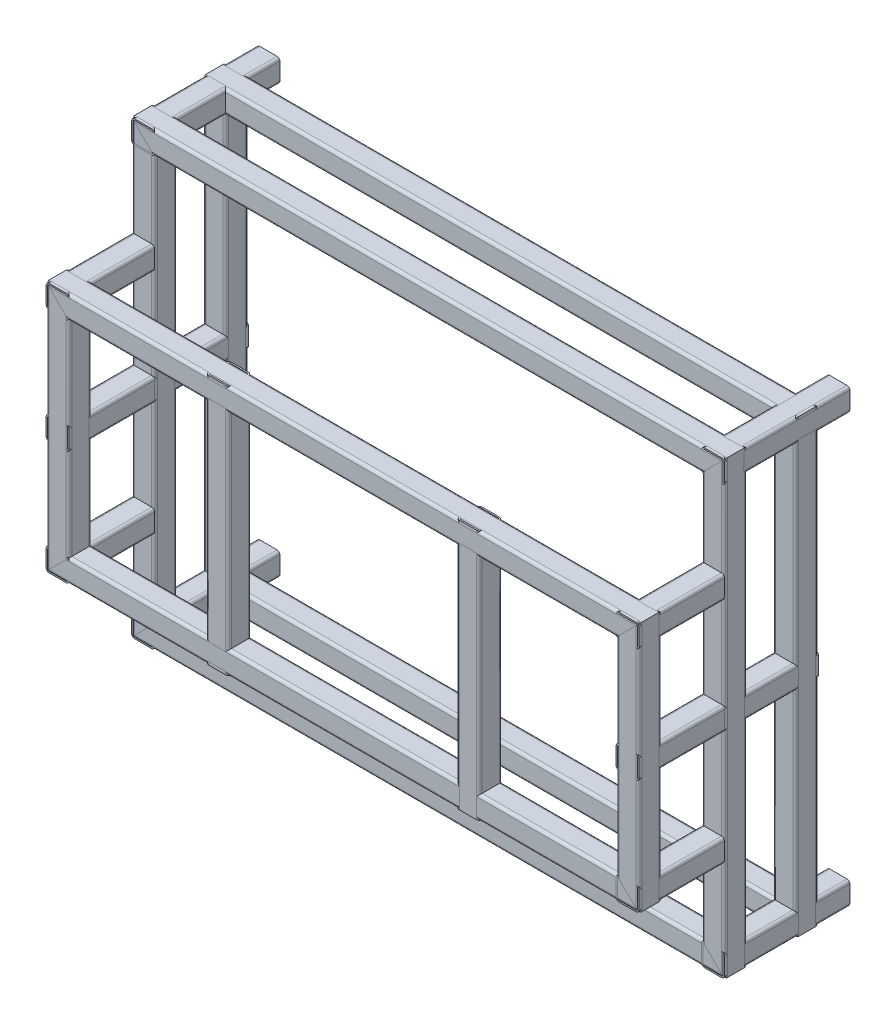
from build123d import *

# Parameters (mm, degrees)
SQUARE_TUBE_80_X_80_X_5_1_DEPTH       = 2194.13708499
SQUARE_TUBE_80_X_80_X_5_1_DEPTH_BACK  = 114.13708499
SQUARE_TUBE_80_X_80_X_5_1_2_DEPTH     = 1108.27416998
SQUARE_TUBE_80_X_80_X_5_1_3_DEPTH     = 2308.27416998
SQUARE_TUBE_80_X_80_X_5_1_4_DEPTH     = 1108.27416998
SQUARE_TUBE_80_X_80_X_5_2_DEPTH       = 880
SQUARE_TUBE_80_X_80_X_5_2_2_DEPTH     = 880
SQUARE_TUBE_80_X_80_X_5_3_DEPTH       = 300
SQUARE_TUBE_80_X_80_X_5_7_DEPTH       = 300
SQUARE_TUBE_80_X_80_X_5_8_DEPTH       = 300
SQUARE_TUBE_80_X_80_X_5_9_DEPTH       = 300
SQUARE_TUBE_80_X_80_X_5_10_DEPTH      = 1694.13708499
SQUARE_TUBE_80_X_80_X_5_10_DEPTH_BACK = 114.13708499
SQUARE_TUBE_80_X_80_X_5_10_2_DEPTH    = 2308.27416998
SQUARE_TUBE_80_X_80_X_5_10_3_DEPTH    = 1808.27416998
SQUARE_TUBE_80_X_80_X_5_10_4_DEPTH    = 2308.27416998
SQUARE_TUBE_80_X_80_X_5_11_DEPTH      = 1694.13708499
SQUARE_TUBE_80_X_80_X_5_11_DEPTH_BACK = 114.13708499
SQUARE_TUBE_80_X_80_X_5_11_2_DEPTH    = 2308.27416998
SQUARE_TUBE_80_X_80_X_5_11_3_DEPTH    = 1808.27416998
SQUARE_TUBE_80_X_80_X_5_11_4_DEPTH    = 2308.27416998
SQUARE_TUBE_80_X_80_X_5_12_DEPTH      = 440
SQUARE_TUBE_80_X_80_X_5_13_DEPTH      = 440
SQUARE_TUBE_80_X_80_X_5_14_DEPTH      = 440
SQUARE_TUBE_80_X_80_X_5_15_DEPTH      = 440
SQUARE_START                          = -300
SQUARE_TUBE_80_X_80_X_5_16_DEPTH      = 300
SQUARE_START_2                        = -630
SQUARE_TUBE_80_X_80_X_5_16_2_DEPTH    = 330


with BuildPart() as part:
    # Sketch15 → Square tube 80 X 80 X 5(1) (new, two sides: drawn at the far end of the back side and taken through both)
    with BuildSketch(Plane(origin=(-1040, -400, -40), x_dir=(0, 0, -1), z_dir=(1, 0, 0)).offset(-SQUARE_TUBE_80_X_80_X_5_1_DEPTH_BACK)):
        with BuildLine():
            Line((-30, -40), (30, -40))
            ThreePointArc((30, -40), (37.071067812, -37.071067812), (40, -30))
            Line((40, -30), (40, 30))
            ThreePointArc((40, 30), (37.071067812, 37.071067812), (30, 40))
            Line((30, 40), (-30, 40))
            ThreePointArc((-30, 40), (-37.071067812, 37.071067812), (-40, 30))
            Line((-40, 30), (-40, -30))
            ThreePointArc((-40, -30), (-37.071067812, -37.071067812), (-30, -40))
        make_face()
        with BuildLine():
            Line((-30, -35), (30, -35))
            ThreePointArc((30, -35), (33.535533906, -33.535533906), (35, -30))
            Line((35, -30), (35, 30))
            ThreePointArc((35, 30), (33.535533906, 33.535533906), (30, 35))
            Line((30, 35), (-30, 35))
            ThreePointArc((-30, 35), (-33.535533906, 33.535533906), (-35, 30))
            Line((-35, 30), (-35, -30))
            ThreePointArc((-35, -30), (-33.535533906, -33.535533906), (-30, -35))
        make_face(mode=Mode.SUBTRACT)
    extrude(amount=SQUARE_TUBE_80_X_80_X_5_1_DEPTH + SQUARE_TUBE_80_X_80_X_5_1_DEPTH_BACK)

    # Square tube 80 X 80 X 5(1) mitre 1
    split(bisect_by=Plane(origin=(-1040, -440, 0), x_dir=(0.707106781, 0.707106781, 0), z_dir=(0.707106781, -0.707106781, 0)), keep=Keep.TOP)

    # Square tube 80 X 80 X 5(1) mitre 2
    split(bisect_by=Plane(origin=(1040, -440, 0), x_dir=(0.707106781, -0.707106781, 0), z_dir=(-0.707106781, -0.707106781, 0)), keep=Keep.TOP)


with BuildPart() as body_2:
    # Sketch15 on segment 2 (carried to segment 2) → Square tube 80 X 80 X 5_1 2 (new body)
    with BuildSketch(Plane(origin=(1000, -554.13708499, -40), x_dir=(0, 0, -1), z_dir=(0, 1, 0))):
        with BuildLine():
            Line((-30, -40), (30, -40))
            ThreePointArc((30, -40), (37.071067812, -37.071067812), (40, -30))
            Line((40, -30), (40, 30))
            ThreePointArc((40, 30), (37.071067812, 37.071067812), (30, 40))
            Line((30, 40), (-30, 40))
            ThreePointArc((-30, 40), (-37.071067812, 37.071067812), (-40, 30))
            Line((-40, 30), (-40, -30))
            ThreePointArc((-40, -30), (-37.071067812, -37.071067812), (-30, -40))
        make_face()
        with BuildLine():
            Line((-30, -35), (30, -35))
            ThreePointArc((30, -35), (33.535533906, -33.535533906), (35, -30))
            Line((35, -30), (35, 30))
            ThreePointArc((35, 30), (33.535533906, 33.535533906), (30, 35))
            Line((30, 35), (-30, 35))
            ThreePointArc((-30, 35), (-33.535533906, 33.535533906), (-35, 30))
            Line((-35, 30), (-35, -30))
            ThreePointArc((-35, -30), (-33.535533906, -33.535533906), (-30, -35))
        make_face(mode=Mode.SUBTRACT)
    extrude(amount=SQUARE_TUBE_80_X_80_X_5_1_2_DEPTH)

    # Square tube 80 X 80 X 5_1 2 mitre 1
    split(bisect_by=Plane(origin=(1040, -440, 0), x_dir=(-0.707106781, 0.707106781, 0), z_dir=(0.707106781, 0.707106781, 0)), keep=Keep.TOP)

    # Square tube 80 X 80 X 5_1 2 mitre 2
    split(bisect_by=Plane(origin=(1040, 440, 0), x_dir=(0.707106781, 0.707106781, 0), z_dir=(0.707106781, -0.707106781, 0)), keep=Keep.TOP)


with BuildPart() as body_3:
    # Sketch15 on segment 3 (carried to segment 3) → Square tube 80 X 80 X 5_1 3 (new body)
    with BuildSketch(Plane(origin=(1154.13708499, 400, -40), x_dir=(0, 0, -1), z_dir=(-1, 0, 0))):
        with BuildLine():
            Line((-30, -40), (30, -40))
            ThreePointArc((30, -40), (37.071067812, -37.071067812), (40, -30))
            Line((40, -30), (40, 30))
            ThreePointArc((40, 30), (37.071067812, 37.071067812), (30, 40))
            Line((30, 40), (-30, 40))
            ThreePointArc((-30, 40), (-37.071067812, 37.071067812), (-40, 30))
            Line((-40, 30), (-40, -30))
            ThreePointArc((-40, -30), (-37.071067812, -37.071067812), (-30, -40))
        make_face()
        with BuildLine():
            Line((-30, -35), (30, -35))
            ThreePointArc((30, -35), (33.535533906, -33.535533906), (35, -30))
            Line((35, -30), (35, 30))
            ThreePointArc((35, 30), (33.535533906, 33.535533906), (30, 35))
            Line((30, 35), (-30, 35))
            ThreePointArc((-30, 35), (-33.535533906, 33.535533906), (-35, 30))
            Line((-35, 30), (-35, -30))
            ThreePointArc((-35, -30), (-33.535533906, -33.535533906), (-30, -35))
        make_face(mode=Mode.SUBTRACT)
    extrude(amount=SQUARE_TUBE_80_X_80_X_5_1_3_DEPTH)

    # Square tube 80 X 80 X 5_1 3 mitre 1
    split(bisect_by=Plane(origin=(-1040, 440, 0), x_dir=(-0.707106781, 0.707106781, 0), z_dir=(0.707106781, 0.707106781, 0)), keep=Keep.TOP)

    # Square tube 80 X 80 X 5_1 3 mitre 2
    split(bisect_by=Plane(origin=(1040, 440, 0), x_dir=(-0.707106781, -0.707106781, 0), z_dir=(-0.707106781, 0.707106781, 0)), keep=Keep.TOP)


with BuildPart() as body_4:
    # Sketch15 on segment 4 (carried to segment 4) → Square tube 80 X 80 X 5_1 4 (new body)
    with BuildSketch(Plane(origin=(-1000, 554.13708499, -40), x_dir=(0, 0, -1), z_dir=(0, -1, 0))):
        with BuildLine():
            Line((-30, -40), (30, -40))
            ThreePointArc((30, -40), (37.071067812, -37.071067812), (40, -30))
            Line((40, -30), (40, 30))
            ThreePointArc((40, 30), (37.071067812, 37.071067812), (30, 40))
            Line((30, 40), (-30, 40))
            ThreePointArc((-30, 40), (-37.071067812, 37.071067812), (-40, 30))
            Line((-40, 30), (-40, -30))
            ThreePointArc((-40, -30), (-37.071067812, -37.071067812), (-30, -40))
        make_face()
        with BuildLine():
            Line((-30, -35), (30, -35))
            ThreePointArc((30, -35), (33.535533906, -33.535533906), (35, -30))
            Line((35, -30), (35, 30))
            ThreePointArc((35, 30), (33.535533906, 33.535533906), (30, 35))
            Line((30, 35), (-30, 35))
            ThreePointArc((-30, 35), (-33.535533906, 33.535533906), (-35, 30))
            Line((-35, 30), (-35, -30))
            ThreePointArc((-35, -30), (-33.535533906, -33.535533906), (-30, -35))
        make_face(mode=Mode.SUBTRACT)
    extrude(amount=SQUARE_TUBE_80_X_80_X_5_1_4_DEPTH)

    # Square tube 80 X 80 X 5_1 4 mitre 1
    split(bisect_by=Plane(origin=(-1040, -440, 0), x_dir=(-0.707106781, -0.707106781, 0), z_dir=(-0.707106781, 0.707106781, 0)), keep=Keep.TOP)

    # Square tube 80 X 80 X 5_1 4 mitre 2
    split(bisect_by=Plane(origin=(-1040, 440, 0), x_dir=(0.707106781, -0.707106781, 0), z_dir=(-0.707106781, -0.707106781, 0)), keep=Keep.TOP)


with BuildPart() as body_5:
    # Sketch1 → Square tube 80 X 80 X 5(2) (new body)
    with BuildSketch(Plane(origin=(440, -440, -40), x_dir=(1, 0, 0), z_dir=(0, 1, 0))):
        with BuildLine():
            Line((-30, -40), (30, -40))
            ThreePointArc((30, -40), (37.071067812, -37.071067812), (40, -30))
            Line((40, -30), (40, 30))
            ThreePointArc((40, 30), (37.071067812, 37.071067812), (30, 40))
            Line((30, 40), (-30, 40))
            ThreePointArc((-30, 40), (-37.071067812, 37.071067812), (-40, 30))
            Line((-40, 30), (-40, -30))
            ThreePointArc((-40, -30), (-37.071067812, -37.071067812), (-30, -40))
        make_face()
        with BuildLine():
            Line((-30, -35), (30, -35))
            ThreePointArc((30, -35), (33.535533906, -33.535533906), (35, -30))
            Line((35, -30), (35, 30))
            ThreePointArc((35, 30), (33.535533906, 33.535533906), (30, 35))
            Line((30, 35), (-30, 35))
            ThreePointArc((-30, 35), (-33.535533906, 33.535533906), (-35, 30))
            Line((-35, 30), (-35, -30))
            ThreePointArc((-35, -30), (-33.535533906, -33.535533906), (-30, -35))
        make_face(mode=Mode.SUBTRACT)
    extrude(amount=SQUARE_TUBE_80_X_80_X_5_2_DEPTH)


with BuildPart() as body_6:
    # Sketch1 on segment 2 (carried to segment 2) → Square tube 80 X 80 X 5_2 2 (new body)
    with BuildSketch(Plane(origin=(-440, -440, -40), x_dir=(1, 0, 0), z_dir=(0, 1, 0))):
        with BuildLine():
            Line((-30, -40), (30, -40))
            ThreePointArc((30, -40), (37.071067812, -37.071067812), (40, -30))
            Line((40, -30), (40, 30))
            ThreePointArc((40, 30), (37.071067812, 37.071067812), (30, 40))
            Line((30, 40), (-30, 40))
            ThreePointArc((-30, 40), (-37.071067812, 37.071067812), (-40, 30))
            Line((-40, 30), (-40, -30))
            ThreePointArc((-40, -30), (-37.071067812, -37.071067812), (-30, -40))
        make_face()
        with BuildLine():
            Line((-30, -35), (30, -35))
            ThreePointArc((30, -35), (33.535533906, -33.535533906), (35, -30))
            Line((35, -30), (35, 30))
            ThreePointArc((35, 30), (33.535533906, 33.535533906), (30, 35))
            Line((30, 35), (-30, 35))
            ThreePointArc((-30, 35), (-33.535533906, 33.535533906), (-35, 30))
            Line((-35, 30), (-35, -30))
            ThreePointArc((-35, -30), (-33.535533906, -33.535533906), (-30, -35))
        make_face(mode=Mode.SUBTRACT)
    extrude(amount=SQUARE_TUBE_80_X_80_X_5_2_2_DEPTH)


with BuildPart() as body_7:
    # Sketch16 → Square tube 80 X 80 X 5(3) (new body)
    with BuildSketch(Plane(origin=(1000, 400, 0), x_dir=(1, 0, 0), z_dir=(0, 0, -1))):
        with BuildLine():
            Line((-30, -40), (30, -40))
            ThreePointArc((30, -40), (37.071067812, -37.071067812), (40, -30))
            Line((40, -30), (40, 30))
            ThreePointArc((40, 30), (37.071067812, 37.071067812), (30, 40))
            Line((30, 40), (-30, 40))
            ThreePointArc((-30, 40), (-37.071067812, 37.071067812), (-40, 30))
            Line((-40, 30), (-40, -30))
            ThreePointArc((-40, -30), (-37.071067812, -37.071067812), (-30, -40))
        make_face()
        with BuildLine():
            Line((-30, -35), (30, -35))
            ThreePointArc((30, -35), (33.535533906, -33.535533906), (35, -30))
            Line((35, -30), (35, 30))
            ThreePointArc((35, 30), (33.535533906, 33.535533906), (30, 35))
            Line((30, 35), (-30, 35))
            ThreePointArc((-30, 35), (-33.535533906, 33.535533906), (-35, 30))
            Line((-35, 30), (-35, -30))
            ThreePointArc((-35, -30), (-33.535533906, -33.535533906), (-30, -35))
        make_face(mode=Mode.SUBTRACT)
    extrude(amount=SQUARE_TUBE_80_X_80_X_5_3_DEPTH)


with BuildPart() as body_8:
    # Sketch17 → Square tube 80 X 80 X 5(7) (new body)
    with BuildSketch(Plane(origin=(1000, -400, 0), x_dir=(1, 0, 0), z_dir=(0, 0, -1))):
        with BuildLine():
            Line((-30, -40), (30, -40))
            ThreePointArc((30, -40), (37.071067812, -37.071067812), (40, -30))
            Line((40, -30), (40, 30))
            ThreePointArc((40, 30), (37.071067812, 37.071067812), (30, 40))
            Line((30, 40), (-30, 40))
            ThreePointArc((-30, 40), (-37.071067812, 37.071067812), (-40, 30))
            Line((-40, 30), (-40, -30))
            ThreePointArc((-40, -30), (-37.071067812, -37.071067812), (-30, -40))
        make_face()
        with BuildLine():
            Line((-30, -35), (30, -35))
            ThreePointArc((30, -35), (33.535533906, -33.535533906), (35, -30))
            Line((35, -30), (35, 30))
            ThreePointArc((35, 30), (33.535533906, 33.535533906), (30, 35))
            Line((30, 35), (-30, 35))
            ThreePointArc((-30, 35), (-33.535533906, 33.535533906), (-35, 30))
            Line((-35, 30), (-35, -30))
            ThreePointArc((-35, -30), (-33.535533906, -33.535533906), (-30, -35))
        make_face(mode=Mode.SUBTRACT)
    extrude(amount=SQUARE_TUBE_80_X_80_X_5_7_DEPTH)


with BuildPart() as body_9:
    # Sketch18 → Square tube 80 X 80 X 5(8) (new body)
    with BuildSketch(Plane(origin=(-1000, -400, 0), x_dir=(1, 0, 0), z_dir=(0, 0, -1))):
        with BuildLine():
            Line((-30, -40), (30, -40))
            ThreePointArc((30, -40), (37.071067812, -37.071067812), (40, -30))
            Line((40, -30), (40, 30))
            ThreePointArc((40, 30), (37.071067812, 37.071067812), (30, 40))
            Line((30, 40), (-30, 40))
            ThreePointArc((-30, 40), (-37.071067812, 37.071067812), (-40, 30))
            Line((-40, 30), (-40, -30))
            ThreePointArc((-40, -30), (-37.071067812, -37.071067812), (-30, -40))
        make_face()
        with BuildLine():
            Line((-30, -35), (30, -35))
            ThreePointArc((30, -35), (33.535533906, -33.535533906), (35, -30))
            Line((35, -30), (35, 30))
            ThreePointArc((35, 30), (33.535533906, 33.535533906), (30, 35))
            Line((30, 35), (-30, 35))
            ThreePointArc((-30, 35), (-33.535533906, 33.535533906), (-35, 30))
            Line((-35, 30), (-35, -30))
            ThreePointArc((-35, -30), (-33.535533906, -33.535533906), (-30, -35))
        make_face(mode=Mode.SUBTRACT)
    extrude(amount=SQUARE_TUBE_80_X_80_X_5_8_DEPTH)


with BuildPart() as body_10:
    # Sketch19 → Square tube 80 X 80 X 5(9) (new body)
    with BuildSketch(Plane(origin=(-1000, 400, 0), x_dir=(1, 0, 0), z_dir=(0, 0, -1))):
        with BuildLine():
            Line((-30, -40), (30, -40))
            ThreePointArc((30, -40), (37.071067812, -37.071067812), (40, -30))
            Line((40, -30), (40, 30))
            ThreePointArc((40, 30), (37.071067812, 37.071067812), (30, 40))
            Line((30, 40), (-30, 40))
            ThreePointArc((-30, 40), (-37.071067812, 37.071067812), (-40, 30))
            Line((-40, 30), (-40, -30))
            ThreePointArc((-40, -30), (-37.071067812, -37.071067812), (-30, -40))
        make_face()
        with BuildLine():
            Line((-30, -35), (30, -35))
            ThreePointArc((30, -35), (33.535533906, -33.535533906), (35, -30))
            Line((35, -30), (35, 30))
            ThreePointArc((35, 30), (33.535533906, 33.535533906), (30, 35))
            Line((30, 35), (-30, 35))
            ThreePointArc((-30, 35), (-33.535533906, 33.535533906), (-35, 30))
            Line((-35, 30), (-35, -30))
            ThreePointArc((-35, -30), (-33.535533906, -33.535533906), (-30, -35))
        make_face(mode=Mode.SUBTRACT)
    extrude(amount=SQUARE_TUBE_80_X_80_X_5_9_DEPTH)


with BuildPart() as body_11:
    # Sketch110 → Square tube 80 X 80 X 5(10) (new, two sides: drawn at the far end of the back side and taken through both)
    with BuildSketch(Plane(origin=(1000, -790, -340), x_dir=(1, 0, 0), z_dir=(0, 1, 0)).offset(-SQUARE_TUBE_80_X_80_X_5_10_DEPTH_BACK)):
        with BuildLine():
            Line((-30, -40), (30, -40))
            ThreePointArc((30, -40), (37.071067812, -37.071067812), (40, -30))
            Line((40, -30), (40, 30))
            ThreePointArc((40, 30), (37.071067812, 37.071067812), (30, 40))
            Line((30, 40), (-30, 40))
            ThreePointArc((-30, 40), (-37.071067812, 37.071067812), (-40, 30))
            Line((-40, 30), (-40, -30))
            ThreePointArc((-40, -30), (-37.071067812, -37.071067812), (-30, -40))
        make_face()
        with BuildLine():
            Line((-30, -35), (30, -35))
            ThreePointArc((30, -35), (33.535533906, -33.535533906), (35, -30))
            Line((35, -30), (35, 30))
            ThreePointArc((35, 30), (33.535533906, 33.535533906), (30, 35))
            Line((30, 35), (-30, 35))
            ThreePointArc((-30, 35), (-33.535533906, 33.535533906), (-35, 30))
            Line((-35, 30), (-35, -30))
            ThreePointArc((-35, -30), (-33.535533906, -33.535533906), (-30, -35))
        make_face(mode=Mode.SUBTRACT)
    extrude(amount=SQUARE_TUBE_80_X_80_X_5_10_DEPTH + SQUARE_TUBE_80_X_80_X_5_10_DEPTH_BACK)

    # Square tube 80 X 80 X 5(10) mitre 1
    split(bisect_by=Plane(origin=(1040, -790, -300), x_dir=(-0.707106781, 0.707106781, 0), z_dir=(0.707106781, 0.707106781, 0)), keep=Keep.TOP)

    # Square tube 80 X 80 X 5(10) mitre 2
    split(bisect_by=Plane(origin=(1040, 790, -300), x_dir=(0.707106781, 0.707106781, 0), z_dir=(0.707106781, -0.707106781, 0)), keep=Keep.TOP)


with BuildPart() as body_12:
    # Sketch110 on segment 2 (carried to segment 2) → Square tube 80 X 80 X 5_10 2 (new body)
    with BuildSketch(Plane(origin=(1154.13708499, 750, -340), x_dir=(0, 1, 0), z_dir=(-1, 0, 0))):
        with BuildLine():
            Line((-30, -40), (30, -40))
            ThreePointArc((30, -40), (37.071067812, -37.071067812), (40, -30))
            Line((40, -30), (40, 30))
            ThreePointArc((40, 30), (37.071067812, 37.071067812), (30, 40))
            Line((30, 40), (-30, 40))
            ThreePointArc((-30, 40), (-37.071067812, 37.071067812), (-40, 30))
            Line((-40, 30), (-40, -30))
            ThreePointArc((-40, -30), (-37.071067812, -37.071067812), (-30, -40))
        make_face()
        with BuildLine():
            Line((-30, -35), (30, -35))
            ThreePointArc((30, -35), (33.535533906, -33.535533906), (35, -30))
            Line((35, -30), (35, 30))
            ThreePointArc((35, 30), (33.535533906, 33.535533906), (30, 35))
            Line((30, 35), (-30, 35))
            ThreePointArc((-30, 35), (-33.535533906, 33.535533906), (-35, 30))
            Line((-35, 30), (-35, -30))
            ThreePointArc((-35, -30), (-33.535533906, -33.535533906), (-30, -35))
        make_face(mode=Mode.SUBTRACT)
    extrude(amount=SQUARE_TUBE_80_X_80_X_5_10_2_DEPTH)

    # Square tube 80 X 80 X 5_10 2 mitre 1
    split(bisect_by=Plane(origin=(-1040, 790, -300), x_dir=(-0.707106781, 0.707106781, 0), z_dir=(0.707106781, 0.707106781, 0)), keep=Keep.TOP)

    # Square tube 80 X 80 X 5_10 2 mitre 2
    split(bisect_by=Plane(origin=(1040, 790, -300), x_dir=(-0.707106781, -0.707106781, 0), z_dir=(-0.707106781, 0.707106781, 0)), keep=Keep.TOP)


with BuildPart() as body_13:
    # Sketch110 on segment 3 (carried to segment 3) → Square tube 80 X 80 X 5_10 3 (new body)
    with BuildSketch(Plane(origin=(-1000, 904.13708499, -340), x_dir=(-1, 0, 0), z_dir=(0, -1, 0))):
        with BuildLine():
            Line((-30, -40), (30, -40))
            ThreePointArc((30, -40), (37.071067812, -37.071067812), (40, -30))
            Line((40, -30), (40, 30))
            ThreePointArc((40, 30), (37.071067812, 37.071067812), (30, 40))
            Line((30, 40), (-30, 40))
            ThreePointArc((-30, 40), (-37.071067812, 37.071067812), (-40, 30))
            Line((-40, 30), (-40, -30))
            ThreePointArc((-40, -30), (-37.071067812, -37.071067812), (-30, -40))
        make_face()
        with BuildLine():
            Line((-30, -35), (30, -35))
            ThreePointArc((30, -35), (33.535533906, -33.535533906), (35, -30))
            Line((35, -30), (35, 30))
            ThreePointArc((35, 30), (33.535533906, 33.535533906), (30, 35))
            Line((30, 35), (-30, 35))
            ThreePointArc((-30, 35), (-33.535533906, 33.535533906), (-35, 30))
            Line((-35, 30), (-35, -30))
            ThreePointArc((-35, -30), (-33.535533906, -33.535533906), (-30, -35))
        make_face(mode=Mode.SUBTRACT)
    extrude(amount=SQUARE_TUBE_80_X_80_X_5_10_3_DEPTH)

    # Square tube 80 X 80 X 5_10 3 mitre 1
    split(bisect_by=Plane(origin=(-1040, -790, -300), x_dir=(-0.707106781, -0.707106781, 0), z_dir=(-0.707106781, 0.707106781, 0)), keep=Keep.TOP)

    # Square tube 80 X 80 X 5_10 3 mitre 2
    split(bisect_by=Plane(origin=(-1040, 790, -300), x_dir=(0.707106781, -0.707106781, 0), z_dir=(-0.707106781, -0.707106781, 0)), keep=Keep.TOP)


with BuildPart() as body_14:
    # Sketch110 on segment 4 (carried to segment 4) → Square tube 80 X 80 X 5_10 4 (new body)
    with BuildSketch(Plane(origin=(-1154.13708499, -750, -340), x_dir=(0, -1, 0), z_dir=(1, 0, 0))):
        with BuildLine():
            Line((-30, -40), (30, -40))
            ThreePointArc((30, -40), (37.071067812, -37.071067812), (40, -30))
            Line((40, -30), (40, 30))
            ThreePointArc((40, 30), (37.071067812, 37.071067812), (30, 40))
            Line((30, 40), (-30, 40))
            ThreePointArc((-30, 40), (-37.071067812, 37.071067812), (-40, 30))
            Line((-40, 30), (-40, -30))
            ThreePointArc((-40, -30), (-37.071067812, -37.071067812), (-30, -40))
        make_face()
        with BuildLine():
            Line((-30, -35), (30, -35))
            ThreePointArc((30, -35), (33.535533906, -33.535533906), (35, -30))
            Line((35, -30), (35, 30))
            ThreePointArc((35, 30), (33.535533906, 33.535533906), (30, 35))
            Line((30, 35), (-30, 35))
            ThreePointArc((-30, 35), (-33.535533906, 33.535533906), (-35, 30))
            Line((-35, 30), (-35, -30))
            ThreePointArc((-35, -30), (-33.535533906, -33.535533906), (-30, -35))
        make_face(mode=Mode.SUBTRACT)
    extrude(amount=SQUARE_TUBE_80_X_80_X_5_10_4_DEPTH)

    # Square tube 80 X 80 X 5_10 4 mitre 1
    split(bisect_by=Plane(origin=(1040, -790, -300), x_dir=(0.707106781, -0.707106781, 0), z_dir=(-0.707106781, -0.707106781, 0)), keep=Keep.TOP)

    # Square tube 80 X 80 X 5_10 4 mitre 2
    split(bisect_by=Plane(origin=(-1040, -790, -300), x_dir=(0.707106781, 0.707106781, 0), z_dir=(0.707106781, -0.707106781, 0)), keep=Keep.TOP)


with BuildPart() as body_15:
    # Sketch111 → Square tube 80 X 80 X 5(11) (new, two sides: drawn at the far end of the back side and taken through both)
    with BuildSketch(Plane(origin=(-1000, -790, -590), x_dir=(1, 0, 0), z_dir=(0, 1, 0)).offset(-SQUARE_TUBE_80_X_80_X_5_11_DEPTH_BACK)):
        with BuildLine():
            Line((-30, -40), (30, -40))
            ThreePointArc((30, -40), (37.071067812, -37.071067812), (40, -30))
            Line((40, -30), (40, 30))
            ThreePointArc((40, 30), (37.071067812, 37.071067812), (30, 40))
            Line((30, 40), (-30, 40))
            ThreePointArc((-30, 40), (-37.071067812, 37.071067812), (-40, 30))
            Line((-40, 30), (-40, -30))
            ThreePointArc((-40, -30), (-37.071067812, -37.071067812), (-30, -40))
        make_face()
        with BuildLine():
            Line((-30, -35), (30, -35))
            ThreePointArc((30, -35), (33.535533906, -33.535533906), (35, -30))
            Line((35, -30), (35, 30))
            ThreePointArc((35, 30), (33.535533906, 33.535533906), (30, 35))
            Line((30, 35), (-30, 35))
            ThreePointArc((-30, 35), (-33.535533906, 33.535533906), (-35, 30))
            Line((-35, 30), (-35, -30))
            ThreePointArc((-35, -30), (-33.535533906, -33.535533906), (-30, -35))
        make_face(mode=Mode.SUBTRACT)
    extrude(amount=SQUARE_TUBE_80_X_80_X_5_11_DEPTH + SQUARE_TUBE_80_X_80_X_5_11_DEPTH_BACK)

    # Square tube 80 X 80 X 5(11) mitre 1
    split(bisect_by=Plane(origin=(-1040, -790, -630), x_dir=(-0.707106781, -0.707106781, 0), z_dir=(-0.707106781, 0.707106781, 0)), keep=Keep.TOP)

    # Square tube 80 X 80 X 5(11) mitre 2
    split(bisect_by=Plane(origin=(-1040, 790, -630), x_dir=(0.707106781, -0.707106781, 0), z_dir=(-0.707106781, -0.707106781, 0)), keep=Keep.TOP)


with BuildPart() as body_16:
    # Sketch111 on segment 2 (carried to segment 2) → Square tube 80 X 80 X 5_11 2 (new body)
    with BuildSketch(Plane(origin=(-1154.13708499, 750, -590), x_dir=(0, -1, 0), z_dir=(1, 0, 0))):
        with BuildLine():
            Line((-30, -40), (30, -40))
            ThreePointArc((30, -40), (37.071067812, -37.071067812), (40, -30))
            Line((40, -30), (40, 30))
            ThreePointArc((40, 30), (37.071067812, 37.071067812), (30, 40))
            Line((30, 40), (-30, 40))
            ThreePointArc((-30, 40), (-37.071067812, 37.071067812), (-40, 30))
            Line((-40, 30), (-40, -30))
            ThreePointArc((-40, -30), (-37.071067812, -37.071067812), (-30, -40))
        make_face()
        with BuildLine():
            Line((-30, -35), (30, -35))
            ThreePointArc((30, -35), (33.535533906, -33.535533906), (35, -30))
            Line((35, -30), (35, 30))
            ThreePointArc((35, 30), (33.535533906, 33.535533906), (30, 35))
            Line((30, 35), (-30, 35))
            ThreePointArc((-30, 35), (-33.535533906, 33.535533906), (-35, 30))
            Line((-35, 30), (-35, -30))
            ThreePointArc((-35, -30), (-33.535533906, -33.535533906), (-30, -35))
        make_face(mode=Mode.SUBTRACT)
    extrude(amount=SQUARE_TUBE_80_X_80_X_5_11_2_DEPTH)

    # Square tube 80 X 80 X 5_11 2 mitre 1
    split(bisect_by=Plane(origin=(1040, 790, -630), x_dir=(-0.707106781, -0.707106781, 0), z_dir=(-0.707106781, 0.707106781, 0)), keep=Keep.TOP)

    # Square tube 80 X 80 X 5_11 2 mitre 2
    split(bisect_by=Plane(origin=(-1040, 790, -630), x_dir=(-0.707106781, 0.707106781, 0), z_dir=(0.707106781, 0.707106781, 0)), keep=Keep.TOP)


with BuildPart() as body_17:
    # Sketch111 on segment 3 (carried to segment 3) → Square tube 80 X 80 X 5_11 3 (new body)
    with BuildSketch(Plane(origin=(1000, 904.13708499, -590), x_dir=(-1, 0, 0), z_dir=(0, -1, 0))):
        with BuildLine():
            Line((-30, -40), (30, -40))
            ThreePointArc((30, -40), (37.071067812, -37.071067812), (40, -30))
            Line((40, -30), (40, 30))
            ThreePointArc((40, 30), (37.071067812, 37.071067812), (30, 40))
            Line((30, 40), (-30, 40))
            ThreePointArc((-30, 40), (-37.071067812, 37.071067812), (-40, 30))
            Line((-40, 30), (-40, -30))
            ThreePointArc((-40, -30), (-37.071067812, -37.071067812), (-30, -40))
        make_face()
        with BuildLine():
            Line((-30, -35), (30, -35))
            ThreePointArc((30, -35), (33.535533906, -33.535533906), (35, -30))
            Line((35, -30), (35, 30))
            ThreePointArc((35, 30), (33.535533906, 33.535533906), (30, 35))
            Line((30, 35), (-30, 35))
            ThreePointArc((-30, 35), (-33.535533906, 33.535533906), (-35, 30))
            Line((-35, 30), (-35, -30))
            ThreePointArc((-35, -30), (-33.535533906, -33.535533906), (-30, -35))
        make_face(mode=Mode.SUBTRACT)
    extrude(amount=SQUARE_TUBE_80_X_80_X_5_11_3_DEPTH)

    # Square tube 80 X 80 X 5_11 3 mitre 1
    split(bisect_by=Plane(origin=(1040, -790, -630), x_dir=(-0.707106781, 0.707106781, 0), z_dir=(0.707106781, 0.707106781, 0)), keep=Keep.TOP)

    # Square tube 80 X 80 X 5_11 3 mitre 2
    split(bisect_by=Plane(origin=(1040, 790, -630), x_dir=(0.707106781, 0.707106781, 0), z_dir=(0.707106781, -0.707106781, 0)), keep=Keep.TOP)


with BuildPart() as body_18:
    # Sketch111 on segment 4 (carried to segment 4) → Square tube 80 X 80 X 5_11 4 (new body)
    with BuildSketch(Plane(origin=(1154.13708499, -750, -590), x_dir=(0, 1, 0), z_dir=(-1, 0, 0))):
        with BuildLine():
            Line((-30, -40), (30, -40))
            ThreePointArc((30, -40), (37.071067812, -37.071067812), (40, -30))
            Line((40, -30), (40, 30))
            ThreePointArc((40, 30), (37.071067812, 37.071067812), (30, 40))
            Line((30, 40), (-30, 40))
            ThreePointArc((-30, 40), (-37.071067812, 37.071067812), (-40, 30))
            Line((-40, 30), (-40, -30))
            ThreePointArc((-40, -30), (-37.071067812, -37.071067812), (-30, -40))
        make_face()
        with BuildLine():
            Line((-30, -35), (30, -35))
            ThreePointArc((30, -35), (33.535533906, -33.535533906), (35, -30))
            Line((35, -30), (35, 30))
            ThreePointArc((35, 30), (33.535533906, 33.535533906), (30, 35))
            Line((30, 35), (-30, 35))
            ThreePointArc((-30, 35), (-33.535533906, 33.535533906), (-35, 30))
            Line((-35, 30), (-35, -30))
            ThreePointArc((-35, -30), (-33.535533906, -33.535533906), (-30, -35))
        make_face(mode=Mode.SUBTRACT)
    extrude(amount=SQUARE_TUBE_80_X_80_X_5_11_4_DEPTH)

    # Square tube 80 X 80 X 5_11 4 mitre 1
    split(bisect_by=Plane(origin=(-1040, -790, -630), x_dir=(0.707106781, 0.707106781, 0), z_dir=(0.707106781, -0.707106781, 0)), keep=Keep.TOP)

    # Square tube 80 X 80 X 5_11 4 mitre 2
    split(bisect_by=Plane(origin=(1040, -790, -630), x_dir=(0.707106781, -0.707106781, 0), z_dir=(-0.707106781, -0.707106781, 0)), keep=Keep.TOP)


with BuildPart() as body_19:
    # Sketch112 → Square tube 80 X 80 X 5(12) (new body)
    with BuildSketch(Plane(origin=(-1000, -750, -300), x_dir=(1, 0, 0), z_dir=(0, 0, -1))):
        with BuildLine():
            Line((-30, -40), (30, -40))
            ThreePointArc((30, -40), (37.071067812, -37.071067812), (40, -30))
            Line((40, -30), (40, 30))
            ThreePointArc((40, 30), (37.071067812, 37.071067812), (30, 40))
            Line((30, 40), (-30, 40))
            ThreePointArc((-30, 40), (-37.071067812, 37.071067812), (-40, 30))
            Line((-40, 30), (-40, -30))
            ThreePointArc((-40, -30), (-37.071067812, -37.071067812), (-30, -40))
        make_face()
        with BuildLine():
            Line((-30, -35), (30, -35))
            ThreePointArc((30, -35), (33.535533906, -33.535533906), (35, -30))
            Line((35, -30), (35, 30))
            ThreePointArc((35, 30), (33.535533906, 33.535533906), (30, 35))
            Line((30, 35), (-30, 35))
            ThreePointArc((-30, 35), (-33.535533906, 33.535533906), (-35, 30))
            Line((-35, 30), (-35, -30))
            ThreePointArc((-35, -30), (-33.535533906, -33.535533906), (-30, -35))
        make_face(mode=Mode.SUBTRACT)
    extrude(amount=SQUARE_TUBE_80_X_80_X_5_12_DEPTH)


with BuildPart() as body_20:
    # Sketch113 → Square tube 80 X 80 X 5(13) (new body)
    with BuildSketch(Plane(origin=(-1000, 750, -300), x_dir=(1, 0, 0), z_dir=(0, 0, -1))):
        with BuildLine():
            Line((-30, -40), (30, -40))
            ThreePointArc((30, -40), (37.071067812, -37.071067812), (40, -30))
            Line((40, -30), (40, 30))
            ThreePointArc((40, 30), (37.071067812, 37.071067812), (30, 40))
            Line((30, 40), (-30, 40))
            ThreePointArc((-30, 40), (-37.071067812, 37.071067812), (-40, 30))
            Line((-40, 30), (-40, -30))
            ThreePointArc((-40, -30), (-37.071067812, -37.071067812), (-30, -40))
        make_face()
        with BuildLine():
            Line((-30, -35), (30, -35))
            ThreePointArc((30, -35), (33.535533906, -33.535533906), (35, -30))
            Line((35, -30), (35, 30))
            ThreePointArc((35, 30), (33.535533906, 33.535533906), (30, 35))
            Line((30, 35), (-30, 35))
            ThreePointArc((-30, 35), (-33.535533906, 33.535533906), (-35, 30))
            Line((-35, 30), (-35, -30))
            ThreePointArc((-35, -30), (-33.535533906, -33.535533906), (-30, -35))
        make_face(mode=Mode.SUBTRACT)
    extrude(amount=SQUARE_TUBE_80_X_80_X_5_13_DEPTH)


with BuildPart() as body_21:
    # Sketch114 → Square tube 80 X 80 X 5(14) (new body)
    with BuildSketch(Plane(origin=(1000, -750, -300), x_dir=(1, 0, 0), z_dir=(0, 0, -1))):
        with BuildLine():
            Line((-30, -40), (30, -40))
            ThreePointArc((30, -40), (37.071067812, -37.071067812), (40, -30))
            Line((40, -30), (40, 30))
            ThreePointArc((40, 30), (37.071067812, 37.071067812), (30, 40))
            Line((30, 40), (-30, 40))
            ThreePointArc((-30, 40), (-37.071067812, 37.071067812), (-40, 30))
            Line((-40, 30), (-40, -30))
            ThreePointArc((-40, -30), (-37.071067812, -37.071067812), (-30, -40))
        make_face()
        with BuildLine():
            Line((-30, -35), (30, -35))
            ThreePointArc((30, -35), (33.535533906, -33.535533906), (35, -30))
            Line((35, -30), (35, 30))
            ThreePointArc((35, 30), (33.535533906, 33.535533906), (30, 35))
            Line((30, 35), (-30, 35))
            ThreePointArc((-30, 35), (-33.535533906, 33.535533906), (-35, 30))
            Line((-35, 30), (-35, -30))
            ThreePointArc((-35, -30), (-33.535533906, -33.535533906), (-30, -35))
        make_face(mode=Mode.SUBTRACT)
    extrude(amount=SQUARE_TUBE_80_X_80_X_5_14_DEPTH)


with BuildPart() as body_22:
    # Sketch115 → Square tube 80 X 80 X 5(15) (new body)
    with BuildSketch(Plane(origin=(1000, 750, -300), x_dir=(1, 0, 0), z_dir=(0, 0, -1))):
        with BuildLine():
            Line((-30, -40), (30, -40))
            ThreePointArc((30, -40), (37.071067812, -37.071067812), (40, -30))
            Line((40, -30), (40, 30))
            ThreePointArc((40, 30), (37.071067812, 37.071067812), (30, 40))
            Line((30, 40), (-30, 40))
            ThreePointArc((-30, 40), (-37.071067812, 37.071067812), (-40, 30))
            Line((-40, 30), (-40, -30))
            ThreePointArc((-40, -30), (-37.071067812, -37.071067812), (-30, -40))
        make_face()
        with BuildLine():
            Line((-30, -35), (30, -35))
            ThreePointArc((30, -35), (33.535533906, -33.535533906), (35, -30))
            Line((35, -30), (35, 30))
            ThreePointArc((35, 30), (33.535533906, 33.535533906), (30, 35))
            Line((30, 35), (-30, 35))
            ThreePointArc((-30, 35), (-33.535533906, 33.535533906), (-35, 30))
            Line((-35, 30), (-35, -30))
            ThreePointArc((-35, -30), (-33.535533906, -33.535533906), (-30, -35))
        make_face(mode=Mode.SUBTRACT)
    extrude(amount=SQUARE_TUBE_80_X_80_X_5_15_DEPTH)


with BuildPart() as body_23:
    # Square tube 80 X 80 X 5(16): read off the stored shape, not the designer's step
    # Square tube 80 X 80 X 5(16) outline → Square tube 80 X 80 X 5(16) (new body)
    with BuildSketch(Plane.XY.offset(SQUARE_START)):
        with BuildLine():
            Line((970, -40), (1030, -40))
            ThreePointArc((1030, -40), (1037.071067812, -37.071067812), (1040, -30))
            Line((1040, -30), (1040, 30))
            ThreePointArc((1040, 30), (1037.071067812, 37.071067812), (1030, 40))
            Line((1030, 40), (970, 40))
            ThreePointArc((970, 40), (962.928932188, 37.071067812), (960, 30))
            Line((960, 30), (960, -30))
            ThreePointArc((960, -30), (962.928932188, -37.071067812), (970, -40))
        make_face()
        with BuildLine():
            ThreePointArc((970, -35), (966.464466094, -33.535533906), (965, -30))
            Line((965, -30), (965, 30))
            ThreePointArc((965, 30), (966.464466094, 33.535533906), (970, 35))
            Line((970, 35), (1030, 35))
            ThreePointArc((1030, 35), (1033.535533906, 33.535533906), (1035, 30))
            Line((1035, 30), (1035, -30))
            ThreePointArc((1035, -30), (1033.535533906, -33.535533906), (1030, -35))
            Line((1030, -35), (970, -35))
        make_face(mode=Mode.SUBTRACT)
    extrude(amount=SQUARE_TUBE_80_X_80_X_5_16_DEPTH)


with BuildPart() as body_24:
    # Square tube 80 X 80 X 5_16 2 outline → Square tube 80 X 80 X 5_16 2 (new body)
    with BuildSketch(Plane.XY.offset(SQUARE_START_2)):
        with BuildLine():
            Line((970, -40), (1030, -40))
            ThreePointArc((1030, -40), (1037.071067812, -37.071067812), (1040, -30))
            Line((1040, -30), (1040, 30))
            ThreePointArc((1040, 30), (1037.071067812, 37.071067812), (1030, 40))
            Line((1030, 40), (970, 40))
            ThreePointArc((970, 40), (962.928932188, 37.071067812), (960, 30))
            Line((960, 30), (960, -30))
            ThreePointArc((960, -30), (962.928932188, -37.071067812), (970, -40))
        make_face()
        with BuildLine():
            ThreePointArc((970, -35), (966.464466094, -33.535533906), (965, -30))
            Line((965, -30), (965, 30))
            ThreePointArc((965, 30), (966.464466094, 33.535533906), (970, 35))
            Line((970, 35), (1030, 35))
            ThreePointArc((1030, 35), (1033.535533906, 33.535533906), (1035, 30))
            Line((1035, 30), (1035, -30))
            ThreePointArc((1035, -30), (1033.535533906, -33.535533906), (1030, -35))
            Line((1030, -35), (970, -35))
        make_face(mode=Mode.SUBTRACT)
    extrude(amount=SQUARE_TUBE_80_X_80_X_5_16_2_DEPTH)


with BuildPart() as body_25:
    # Square tube 80 X 80 X 5(17): read off the stored shape, not the designer's step
    # Square tube 80 X 80 X 5(17): copy of body 23
    add(body_23.part.moved(Location((-2000, 0, 0))))


with BuildPart() as body_26:
    # Square tube 80 X 80 X 5_17 2: copy of body 24
    add(body_24.part.moved(Location((-2000, 0, 0))))


solid = Compound([part.part, body_2.part, body_3.part, body_4.part, body_5.part, body_6.part, body_7.part, body_8.part, body_9.part, body_10.part, body_11.part, body_12.part, body_13.part, body_14.part, body_15.part, body_16.part, body_17.part, body_18.part, body_19.part, body_20.part, body_21.part, body_22.part, body_23.part, body_24.part, body_25.part, body_26.part])
